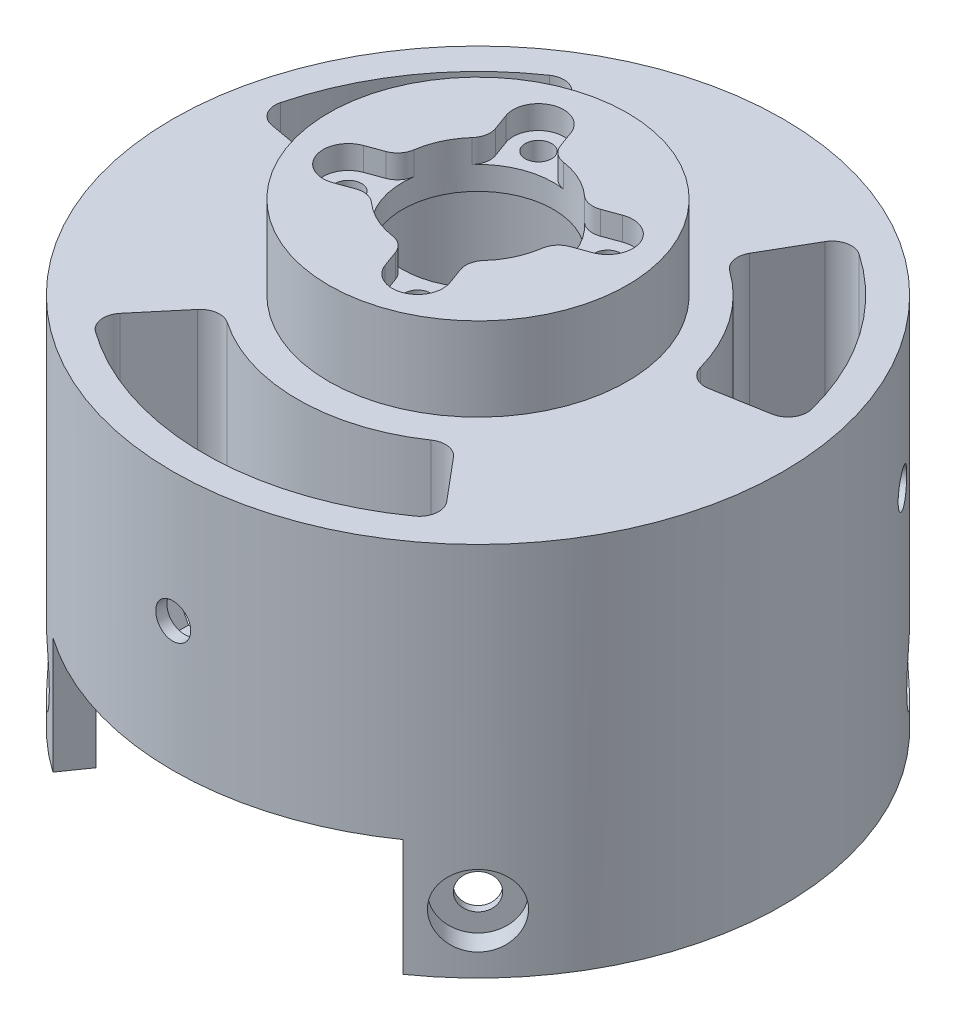
from build123d import *

# Parameters (mm, degrees)
BOSS_EXTRUDE1_DEPTH            = 44
CBORE_FOR_M3_SHCS1_D           = 3.4
CBORE_FOR_M3_SHCS1_CBORE_D     = 6.5
CBORE_FOR_M3_SHCS1_CBORE_DEPTH = 3
CIRPATTERN1_COUNT              = 4
SKETCH4_R                      = 16.2
CUT_EXTRUDE1_DEPTH             = 38
SKETCH5_R                      = 9.7
CUT_EXTRUDE2_DEPTH             = 66.498740446
SKETCH7_R                      = 42.162239665
BOSS_EXTRUDE2_DEPTH            = 44
CUT_EXTRUDE3_DEPTH             = 69.288628024
CUT_EXTRUDE3_DEPTH_BACK        = 69.288628024
SKETCH13_R                     = 35.25
SKETCH13_R_2                   = 19.2
BOSS_EXTRUDE4_DEPTH            = 33.28705169
SKETCH17_R                     = 23.2
SKETCH17_R_2                   = 19.2
BOSS_EXTRUDE5_DEPTH            = 33.28705169
FILLET2_R                      = 2.5
CUT_EXTRUDE5_START             = -10
SKETCH20_R                     = 2.25
CUT_EXTRUDE5_DEPTH             = 109.417716904
CUT_EXTRUDE6_START             = -10
CUT_EXTRUDE6_DEPTH             = 12.5
CIRPATTERN2_COUNT              = 3
CIRPATTERN2_ANGLE              = 250
TEMPORARY_PROBNABLY_DEPTH      = 3
ALSO_PROBABLY_TEMPORARY_R      = 2.5
BOSS_EXTRUDE6_DEPTH            = 15
SKETCH28_R                     = 2.25
CUT_EXTRUDE7_DEPTH             = 112.484504352
CUT_EXTRUDE7_DIRECTION_2_REACH = 113.485
SKETCH29_R                     = 4.6
SKETCH29_R_2                   = 2.25
CUT_EXTRUDE8_DEPTH             = 3
MIRROR2_START                  = -40
MIRROR2_OUTLINE_R              = 4.6
MIRROR2_DEPTH                  = 3.75
MIRROR2_START_2                = 36.25
MIRROR2_2_OUTLINE_R            = 4.6
MIRROR2_2_DEPTH                = 3.75
MIRROR2_START_3                = -36.25
MIRROR2_3_OUTLINE_R            = 2.25
MIRROR2_3_DEPTH                = 72.5
MIRROR2_4_OUTLINE_R            = 4.6
MIRROR2_4_DEPTH                = 3.75
MIRROR2_START_4                = 0.891436654
MIRROR2_5_OUTLINE_R            = 2.25
MIRROR2_5_DEPTH                = 35.358563346
SKETCH31_OUTSIDE_W             = 112.934
SKETCH31_OUTSIDE_H             = 112.934
SKETCH31_OUTSIDE_R             = 39.25
CUT_EXTRUDE9_DEPTH             = 77.726451075


with BuildPart() as part:
    # Sketch1 → Boss-Extrude1 (new body)
    with BuildSketch(Plane(origin=(0, 0, 0), x_dir=(1, 0, 0), z_dir=(0, 1, 0))):
        with BuildLine():
            Line((-29.85, 23.917357714), (-29.85, -23.917357714))
            ThreePointArc((-29.85, -23.917357714), (0, -38.25), (29.85, -23.917357714))
            Line((29.85, -23.917357714), (29.85, 23.917357714))
            ThreePointArc((29.85, 23.917357714), (0, 38.25), (-29.85, 23.917357714))
        make_face()
    extrude(amount=BOSS_EXTRUDE1_DEPTH)

    # CBORE for M3 SHCS1 (through all)
    with Locations(Plane(origin=(0, 44, 0), x_dir=(1, 0, 0), z_dir=(0, 1, 0))):
        with Locations((-4.446261863, 12.21600407)):
            cbore_for_m3_shcs1 = CounterBoreHole(CBORE_FOR_M3_SHCS1_D / 2, CBORE_FOR_M3_SHCS1_CBORE_D / 2, CBORE_FOR_M3_SHCS1_CBORE_DEPTH)

    # CirPattern1: CBORE for M3 SHCS1 ×4 about axis
    cirpattern1_axis = Axis((0, 0, 0), (0, 1, 0))
    for i in range(1, CIRPATTERN1_COUNT):
        add(cbore_for_m3_shcs1.rotate(cirpattern1_axis, i * 360 / CIRPATTERN1_COUNT), mode=Mode.SUBTRACT)

    # Sketch4 → Cut-Extrude1 (cut)
    with BuildSketch(Plane.XZ):
        with Locations(Location((0, 0, 0), (0, 0, 270))):
            Circle(SKETCH4_R)
    extrude(amount=-CUT_EXTRUDE1_DEPTH, mode=Mode.SUBTRACT)

    # Sketch5 → Cut-Extrude2 (cut, through all)
    with BuildSketch(Plane(origin=(0, 44, 0), x_dir=(1, 0, 0), z_dir=(0, 1, 0))):
        with Locations(Location((0, 0, 0), (0, 0, 270))):
            Circle(SKETCH5_R)
    extrude(amount=-CUT_EXTRUDE2_DEPTH, mode=Mode.SUBTRACT)

    # Sketch7 → Boss-Extrude2 (add)
    with BuildSketch(Plane.XZ):
        with Locations(Location((0, 0, 0), (0, 0, 270))):
            Circle(SKETCH7_R)
        with BuildLine():
            Line((29.85, 23.917357714), (29.85, -23.917357714))
            ThreePointArc((29.85, -23.917357714), (0, -38.25), (-29.85, -23.917357714))
            Line((-29.85, -23.917357714), (-29.85, 23.917357714))
            ThreePointArc((-29.85, 23.917357714), (0, 38.25), (29.85, 23.917357714))
        make_face(mode=Mode.SUBTRACT)
    extrude(amount=-BOSS_EXTRUDE2_DEPTH)

    # Sketch9 → Cut-Revolve2 (revolve, cut)
    with BuildSketch(Plane(origin=(0, 0, 0), x_dir=(0, 0, -1), z_dir=(1, 0, 0)), mode=Mode.PRIVATE) as cut_revolve2_sk:
        Polygon((-42.162239665, 0), (-38.31273847, 44), (-42.162239665, 44), align=None)
    revolve(cut_revolve2_sk.sketch.rotate(Axis((0, 0, 0), (0, 1, 0)), 180), axis=Axis((0, 0, 0), (0, 1, 0)), mode=Mode.SUBTRACT)

    # Sketch10 → Cut-Revolve3 (revolve, cut)
    with BuildSketch(Plane(origin=(0, 0, 0), x_dir=(0, 0, -1), z_dir=(1, 0, 0)), mode=Mode.PRIVATE) as cut_revolve3_sk:
        Polygon((-19.2, 44), (-19.2, 33.28705169), (-39.25, 33.28705169), (-38.31273847, 44), align=None)
    revolve(cut_revolve3_sk.sketch.rotate(Axis((0, 0, 0), (0, 1, 0)), 180), axis=Axis((0, 0, 0), (0, 1, 0)), mode=Mode.SUBTRACT)

    # Sketch13 → Cut-Extrude3 (cut, two sides: drawn at the far end of the back side and taken through both)
    with BuildSketch(Plane(origin=(0, 33.28705169, 0), x_dir=(1, 0, 0), z_dir=(0, 1, 0)).offset(-CUT_EXTRUDE3_DEPTH_BACK)):
        with Locations(Location((0, 0, 0), (0, 0, 270))):
            Circle(SKETCH13_R)
        with Locations(Location((0, 0, 0), (0, 0, 90))):
            Circle(SKETCH13_R_2, mode=Mode.SUBTRACT)
    extrude(amount=CUT_EXTRUDE3_DEPTH + CUT_EXTRUDE3_DEPTH_BACK, mode=Mode.SUBTRACT)


with BuildPart() as cut_extrude3_piece_1:
    # of the separate pieces the step leaves, piece 1, a body of its own (cut_extrude3_pieces)
    add(part.part.solids().sort_by_distance((0, 0, -42.162239665))[0])



with BuildPart() as cut_extrude3_piece_2:
    # of the separate pieces the step leaves, piece 2, a body of its own (cut_extrude3_pieces)
    add(part.part.solids().sort_by_distance((0, 0, -19.2))[0])


with BuildPart() as cut_extrude3_piece_1_1:
    add(cut_extrude3_piece_1.part)

    add(cut_extrude3_piece_2.part)  # Boss-Extrude4 merges Cut-Extrude3 piece 2
    # Sketch16 → Boss-Extrude4 (add)
    with BuildSketch(Plane.XZ):
        with BuildLine():
            Line((-17.625, -30.527395483), (-9.6, -16.627687753))
            ThreePointArc((-9.6, -16.627687753), (0, -19.2), (9.6, -16.627687753))
            Line((9.6, -16.627687753), (17.625, -30.527395483))
            ThreePointArc((17.625, -30.527395483), (0, -35.25), (-17.625, -30.527395483))
        make_face()
        with BuildLine():
            Line((-34.714473294, -6.121098263), (-18.908308858, -3.334045011))
            ThreePointArc((-18.908308858, -3.334045011), (-18.042098319, 6.566786752), (-12.341522106, 14.708053308))
            Line((-12.341522106, 14.708053308), (-22.658263241, 27.00306662))
            ThreePointArc((-22.658263241, 27.00306662), (-33.124164883, 12.056210052), (-34.714473294, -6.121098263))
        make_face()
        with BuildLine():
            Line((22.658263241, 27.00306662), (12.341522106, 14.708053308))
            ThreePointArc((12.341522106, 14.708053308), (18.042098319, 6.566786752), (18.908308858, -3.334045011))
            Line((18.908308858, -3.334045011), (34.714473294, -6.121098263))
            ThreePointArc((34.714473294, -6.121098263), (33.124164883, 12.056210052), (22.658263241, 27.00306662))
        make_face()
    extrude(amount=-BOSS_EXTRUDE4_DEPTH)

    # Sketch17 → Boss-Extrude5 (add)
    with BuildSketch(Plane(origin=(0, 33.28705169, 0), x_dir=(1, 0, 0), z_dir=(0, 1, 0))):
        Circle(SKETCH17_R)
        with Locations(Location((0, 0, 0), (0, 0, 90))):
            Circle(SKETCH17_R_2, mode=Mode.SUBTRACT)
    extrude(amount=-BOSS_EXTRUDE5_DEPTH)

    # Fillet2
    fillet2_edges = [cut_extrude3_piece_1_1.edges().sort_by_distance(p)[0] for p in [
        (-17.625, 16.643525845, -30.527395483),
        (17.625, 16.643525845, -30.527395483),
        (34.714473294, 16.643525845, -6.121098263),
        (22.658263241, 16.643525845, 27.00306662),
        (-22.658263241, 16.643525845, 27.00306662),
        (-34.714473294, 16.643525845, -6.121098263),
        (-14.912672545, 16.643525845, 17.77223108),
        (11.6, 16.643525845, -20.091789368),
        (22.84753987, 16.643525845, -4.028637722),
        (14.912672545, 16.643525845, 17.77223108),
        (-11.6, 16.643525845, -20.091789368),
        (-22.84753987, 16.643525845, -4.028637722),
    ]]
    fillet(fillet2_edges, radius=FILLET2_R)

    # Sketch20 → Cut-Extrude5 (cut)
    with BuildSketch(Plane(origin=(-28.875109561, 16.643525845, -20.218569381), x_dir=(-0.5735764363510477, 0, 0.8191520442889908), z_dir=(-0.8191520442889908, 0, -0.5735764363510477)).offset(CUT_EXTRUDE5_START)):
        with Locations(Location((0, 0, 0), (0, 0, 180))):
            Circle(SKETCH20_R)
    cut_extrude5 = extrude(amount=CUT_EXTRUDE5_DEPTH, mode=Mode.SUBTRACT)

    # Sketch21 → Cut-Extrude6 (cut)
    with BuildSketch(Plane(origin=(-28.875109561, 16.643525845, -20.218569381), x_dir=(-0.5735764363510477, 0, 0.8191520442889908), z_dir=(-0.8191520442889908, 0, -0.5735764363510477)).offset(CUT_EXTRUDE6_START)):
        Polygon((4.041451884, 0), (2.020725942, 3.5), (-2.020725942, 3.5), (-4.041451884, 0), (-2.020725942, -3.5), (2.020725942, -3.5), align=None)
    cut_extrude6 = extrude(amount=CUT_EXTRUDE6_DEPTH, mode=Mode.SUBTRACT)

    # CirPattern2: Cut-Extrude5, Cut-Extrude6 ×3 about axis
    cirpattern2_axis = Axis((0, 0, 0), (0, 1, 0))
    add([cut_extrude5.rotate(cirpattern2_axis, i * CIRPATTERN2_ANGLE / (CIRPATTERN2_COUNT - 1)) for i in range(1, CIRPATTERN2_COUNT)], mode=Mode.SUBTRACT)
    add([cut_extrude6.rotate(cirpattern2_axis, i * CIRPATTERN2_ANGLE / (CIRPATTERN2_COUNT - 1)) for i in range(1, CIRPATTERN2_COUNT)], mode=Mode.SUBTRACT)

    # Sketch22 → temporary_probnably (cut)
    with BuildSketch(Plane(origin=(0, 44, 0), x_dir=(1, 0, 0), z_dir=(0, 1, 0))):
        with BuildLine():
            Line((-11.104438604, -7.500262881), (-1.942435552, -4.165566483))
            Line((-1.942435552, -4.165566483), (1.392260846, -13.327569536))
            ThreePointArc((1.392260846, -13.327569536), (5.557827329, -15.270005088), (7.500262881, -11.104438604))
            Line((7.500262881, -11.104438604), (4.165566483, -1.942435552))
            Line((4.165566483, -1.942435552), (13.327569536, 1.392260846))
            ThreePointArc((13.327569536, 1.392260846), (15.270005088, 5.557827329), (11.104438604, 7.500262881))
            Line((11.104438604, 7.500262881), (1.942435552, 4.165566483))
            Line((1.942435552, 4.165566483), (-1.392260846, 13.327569536))
            ThreePointArc((-1.392260846, 13.327569536), (-5.557827329, 15.270005088), (-7.500262881, 11.104438604))
            Line((-7.500262881, 11.104438604), (-4.165566483, 1.942435552))
            Line((-4.165566483, 1.942435552), (-13.327569536, -1.392260846))
            ThreePointArc((-13.327569536, -1.392260846), (-15.270005088, -5.557827329), (-11.104438604, -7.500262881))
        make_face()
    extrude(amount=-TEMPORARY_PROBNABLY_DEPTH, mode=Mode.SUBTRACT)

    # also_probably_temporary
    # the kernel refuses this fillet: 2.5 mm, written as the material it takes off along each edge
    with BuildSketch(Plane(origin=(-9.699733991, 41, 0.071836692), x_dir=(0.06710224820199669, 0, -0.9977461041197995), z_dir=(0, 1, 0)), Plane(origin=(-0.071836692, 41, -9.699733991), x_dir=(0.9977461041198002, 0, 0.06710224820198499), z_dir=(0, 1, 0)), Plane(origin=(9.699733991, 41, -0.071836692), x_dir=(-0.06710224820198839, 0, 0.9977461041198), z_dir=(0, 1, 0)), Plane(origin=(0.071836692, 41, 9.699733991), x_dir=(-0.997746104119798, 0, -0.06710224820201754), z_dir=(0, 1, 0))) as also_probably_temporary_piece_1:
        with BuildLine():
            CenterArc((1.631321377, 2.493054484), ALSO_PROBABLY_TEMPORARY_R, 203.847566724, 61.880539035)
            Line((-0.65523945, 1.482292601), (0, 0))
            ThreePointArc((0, 0), (0.722548738, 0.026948603), (1.445097475, 0))
        make_face()
    extrude(amount=7.051643257, mode=Mode.SUBTRACT)
    with BuildSketch(Plane(origin=(-7.476603059, 41, 6.179838727), x_dir=(0.6927421376971379, 0, 0.7211853649782417), z_dir=(0, 1, 0)), Plane(origin=(-6.179838727, 41, -7.476603059), x_dir=(-0.7211853649782275, 0, 0.6927421376971526), z_dir=(0, 1, 0)), Plane(origin=(7.476603059, 41, -6.179838727), x_dir=(-0.6927421376971437, 0, -0.7211853649782362), z_dir=(0, 1, 0)), Plane(origin=(6.179838727, 41, 7.476603059), x_dir=(0.7211853649782349, 0, -0.692742137697145), z_dir=(0, 1, 0))) as also_probably_temporary_piece_2:
        with BuildLine():
            CenterArc((1.631321377, -2.493054484), ALSO_PROBABLY_TEMPORARY_R, 94.271894241, 61.880539035)
            Line((-0.65523945, -1.482292601), (0, 0))
            ThreePointArc((0, 0), (0.722548738, -0.026948603), (1.445097475, 0))
        make_face()
    extrude(amount=7.051643257, mode=Mode.SUBTRACT)

    # Sketch25 → Boss-Extrude6 (add)
    with BuildSketch(Plane.XZ):
        with BuildLine():
            Line((-20.218569381, 28.875109561), (-22.512875127, 32.151717738))
            ThreePointArc((-22.512875127, 32.151717738), (-39.25, 0), (-22.512875127, -32.151717738))
            Line((-22.512875127, -32.151717738), (-20.218569381, -28.875109561))
            ThreePointArc((-20.218569381, -28.875109561), (-35.25, 0), (-20.218569381, 28.875109561))
        make_face()
        with BuildLine():
            Line((20.218569381, 28.875109561), (22.512875127, 32.151717738))
            ThreePointArc((22.512875127, 32.151717738), (39.25, 0), (22.512875127, -32.151717738))
            Line((22.512875127, -32.151717738), (20.218569381, -28.875109561))
            ThreePointArc((20.218569381, -28.875109561), (35.25, 0), (20.218569381, 28.875109561))
        make_face()
    extrude(amount=BOSS_EXTRUDE6_DEPTH)

    # Sketch28 → Cut-Extrude7 (cut)
    with BuildSketch(Plane(origin=(-27.753941162, -7.5, 27.753941162), x_dir=(0.7071067811865488, 0, 0.7071067811865462), z_dir=(-0.7071067811865462, 0, 0.7071067811865488))):
        with Locations(Location((0, 0, 0), (0, 0, 180))):
            Circle(SKETCH28_R)
    extrude(amount=CUT_EXTRUDE7_DEPTH, mode=Mode.SUBTRACT)

    # Sketch28 → Cut-Extrude7 direction 2 (cut, up to next)
    with BuildSketch(Plane(origin=(-27.753941162, -7.5, 27.753941162), x_dir=(0.7071067811865488, 0, 0.7071067811865462), z_dir=(-0.7071067811865462, 0, 0.7071067811865488)), mode=Mode.PRIVATE) as cut_extrude7_direction_2_sk1:
        with Locations(Location((0, 0, 0), (0, 0, 180))):
            Circle(SKETCH28_R)
    cut_extrude7_direction_2_tool1 = extrude(cut_extrude7_direction_2_sk1.sketch, amount=-CUT_EXTRUDE7_DIRECTION_2_REACH, mode=Mode.PRIVATE) & cut_extrude3_piece_1_1.part
    add(cut_extrude7_direction_2_tool1.solids().sort_by_distance((-27.753941, -7.5, 27.753941))[0], mode=Mode.SUBTRACT)

    # Sketch29 → Cut-Extrude8 (cut)
    with BuildSketch(Plane(origin=(-27.753941162, -7.5, 27.753941162), x_dir=(0.7071067811865488, 0, 0.7071067811865462), z_dir=(-0.7071067811865462, 0, 0.7071067811865488))):
        Circle(SKETCH29_R)
        Circle(SKETCH29_R_2, mode=Mode.SUBTRACT)
    extrude(amount=-CUT_EXTRUDE8_DEPTH, mode=Mode.SUBTRACT)

    # Mirror2: read off the stored shape, not the designer's step
    # Mirror2 outline → Mirror2 (cut)
    with BuildSketch(Plane(origin=(0, 0, 0), x_dir=(0.707106781186549, 0, -0.707106781186546), z_dir=(0.707106781186546, 0, 0.707106781186549)).offset(MIRROR2_START)):
        with Locations((0, -7.5)):
            Circle(MIRROR2_OUTLINE_R)
    extrude(amount=MIRROR2_DEPTH, mode=Mode.SUBTRACT)

    # Mirror2 2 outline → Mirror2 2 (cut)
    with BuildSketch(Plane(origin=(0, 0, 0), x_dir=(0.707106781186549, 0, -0.707106781186546), z_dir=(0.707106781186546, 0, 0.707106781186549)).offset(MIRROR2_START_2)):
        with Locations((0, -7.5)):
            Circle(MIRROR2_2_OUTLINE_R)
    extrude(amount=MIRROR2_2_DEPTH, mode=Mode.SUBTRACT)

    # Mirror2 3 outline → Mirror2 3 (cut)
    with BuildSketch(Plane(origin=(0, 0, 0), x_dir=(0.707106781186549, 0, -0.707106781186546), z_dir=(0.707106781186546, 0, 0.707106781186549)).offset(MIRROR2_START_3)):
        with Locations((0, -7.5)):
            Circle(MIRROR2_3_OUTLINE_R)
    extrude(amount=MIRROR2_3_DEPTH, mode=Mode.SUBTRACT)

    # Mirror2 4 outline → Mirror2 4 (cut)
    with BuildSketch(Plane(origin=(0, 0, 0), x_dir=(0.707106781186549, 0, 0.707106781186546), z_dir=(0.707106781186546, 0, -0.707106781186549)).offset(MIRROR2_START_2)):
        with Locations((0, 7.5)):
            Circle(MIRROR2_4_OUTLINE_R)
    extrude(amount=MIRROR2_4_DEPTH, mode=Mode.SUBTRACT)

    # Mirror2 5 outline → Mirror2 5 (cut)
    with BuildSketch(Plane(origin=(0, 0, 0), x_dir=(0.707106781186549, 0, 0.707106781186546), z_dir=(0.707106781186546, 0, -0.707106781186549)).offset(MIRROR2_START_4)):
        with Locations((0, 7.5)):
            Circle(MIRROR2_5_OUTLINE_R)
    extrude(amount=MIRROR2_5_DEPTH, mode=Mode.SUBTRACT)

    # Sketch31 outside → Cut-Extrude9 (cut, through all)
    with BuildSketch(Plane(origin=(0, 33.28705169, 0), x_dir=(1, 0, 0), z_dir=(0, 1, 0))):
        Rectangle(SKETCH31_OUTSIDE_W, SKETCH31_OUTSIDE_H)
        with Locations(Location((0, 0, 0), (0, 0, 270))):
            Circle(SKETCH31_OUTSIDE_R, mode=Mode.SUBTRACT)
    extrude(amount=-CUT_EXTRUDE9_DEPTH, mode=Mode.SUBTRACT)


solid = cut_extrude3_piece_1_1.part
